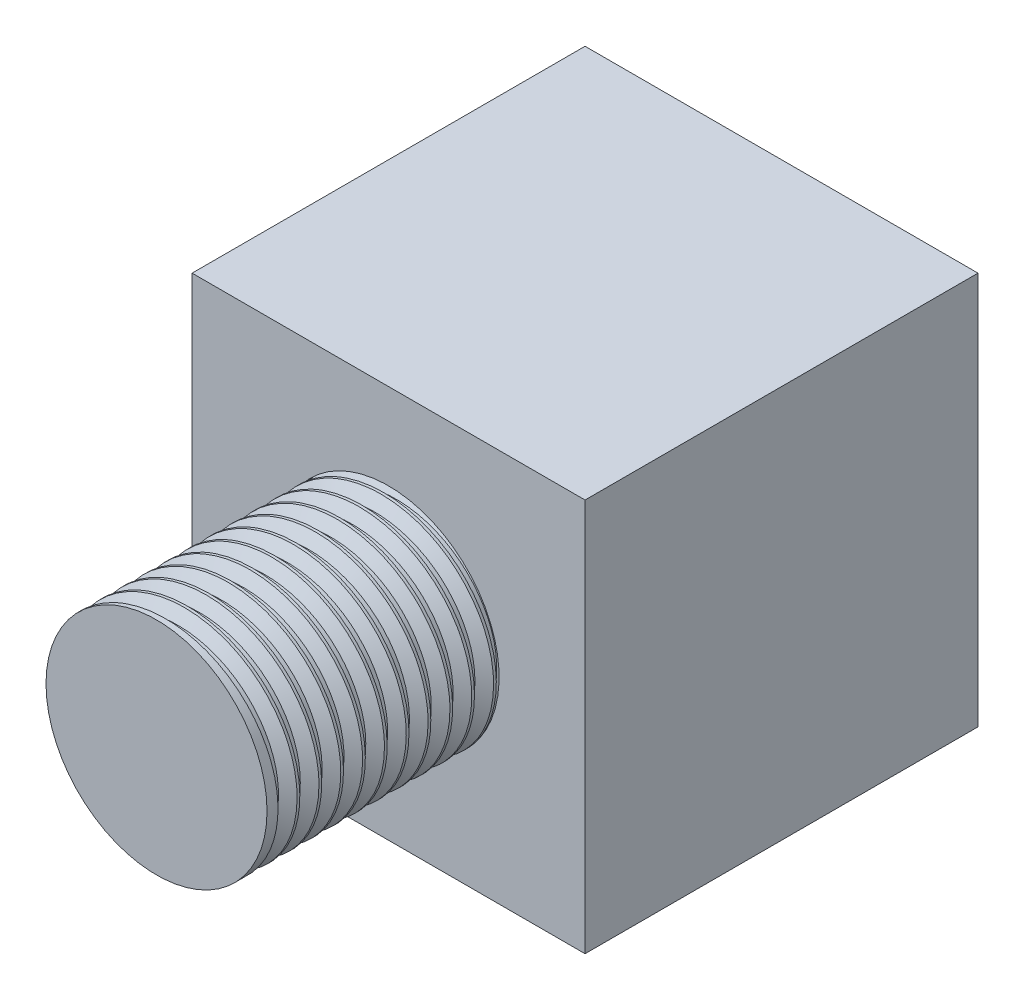
from build123d import *

# Parameters (mm, degrees)
SKETCH1_W                    = 25.4
SKETCH1_H                    = 25.4
BOSS_EXTRUDE1_DEPTH          = 25.4
SKETCH2_R                    = 7.14375
BOSS_EXTRUDE2_DEPTH          = 15
F_9_16_18_TAPPED_HOLE3_D     = 13.09624
F_9_16_18_TAPPED_HOLE3_DEPTH = 14.9999954
F_9_16_18_TAPPED_HOLE3_TIP   = 3.934507437
THREAD1_PITCH                = 1.411111111


with BuildPart() as part:
    # Sketch1 → Boss-Extrude1 (new body)
    with BuildSketch(Plane.XY):
        Rectangle(SKETCH1_W, SKETCH1_H)
    extrude(amount=BOSS_EXTRUDE1_DEPTH)

    # Sketch2 → Boss-Extrude2 (add)
    with BuildSketch(Plane.XY.offset(25.4)):
        with Locations(Location((0, 0, 0), (0, 0, 180))):
            Circle(SKETCH2_R)
    extrude(amount=BOSS_EXTRUDE2_DEPTH)

    # 9/16-18 Tapped Hole3
    with Locations(Plane(origin=(0, 0, 0), x_dir=(1, 0, 0), z_dir=(0, 0, -1))):
        with Locations((0, 0)):
            Hole(F_9_16_18_TAPPED_HOLE3_D / 2, depth=F_9_16_18_TAPPED_HOLE3_DEPTH)
            with Locations((0, 0, -(F_9_16_18_TAPPED_HOLE3_DEPTH + F_9_16_18_TAPPED_HOLE3_TIP / 2))):  # 118° drill point
                Cone(0, F_9_16_18_TAPPED_HOLE3_D / 2, F_9_16_18_TAPPED_HOLE3_TIP, mode=Mode.SUBTRACT)

    # Thread1: the profile of Thread Profile1 profile screwed along a right-hand helix of 10.629921 turns, 8 arcs to a turn; built about Z, then put on its axis
    thread1_z = Axis((0, 0, 0), (0, 0, 1))
    thread1_corners = [(7.14405, 0, -0.000173205), (7.14405, 0, 1.234895423), (6.37996371, 0, 0.793749998), (6.37996371, 0, 0.44097222)]
    with BuildLine(mode=Mode.PRIVATE) as thread1_profile:
        Line(thread1_corners[0], thread1_corners[1])
        Line(thread1_corners[1], thread1_corners[2])
        Line(thread1_corners[2], thread1_corners[3])
        Line(thread1_corners[3], thread1_corners[0])
    thread1_cap = Face(thread1_profile.wire())
    thread1_turn_angles = [0, 22.5, 45, 67.5, 90, 112.5, 135, 157.5, 180, 202.5, 225, 247.5, 270, 292.5, 315, 337.5, 360]
    thread1_turn_weights = [1, 0.9238795325112867, 1, 0.9238795325112867, 1, 0.9238795325112867, 1, 0.9238795325112867, 1, 0.9238795325112867, 1, 0.9238795325112867, 1, 0.9238795325112867, 1, 0.9238795325112867, 1]
    thread1_turn_rails = [Edge.make_bspline([Vector(p[0], p[1], 0).rotate(thread1_z, thread1_turn_angles[k]) / thread1_turn_weights[k] + Vector(0, 0, p[2] + THREAD1_PITCH * thread1_turn_angles[k] / 360) for k in range(17)], [0, 0, 0, 1, 1, 2, 2, 3, 3, 4, 4, 5, 5, 6, 6, 7, 7, 8, 8, 8], 2, thread1_turn_weights) for p in thread1_corners]
    thread1_turn_sides = [Face.make_surface_from_curves(thread1_turn_rails[p[0]], thread1_turn_rails[p[1]]) for p in [(0, 1), (1, 2), (2, 3), (3, 0)]]
    thread1_last_angles = [3600, 3622.5, 3645, 3667.5, 3690, 3712.5, 3735, 3757.5, 3780, 3802.5, 3825, 3825.885826772, 3826.771653543]
    thread1_last_weights = [1, 0.9238795325112867, 1, 0.9238795325112867, 1, 0.9238795325112867, 1, 0.9238795325112867, 1, 0.9238795325112867, 1, 0.999880487400795, 1]
    thread1_last_rails = [Edge.make_bspline([Vector(p[0], p[1], 0).rotate(thread1_z, thread1_last_angles[k]) / thread1_last_weights[k] + Vector(0, 0, p[2] + THREAD1_PITCH * thread1_last_angles[k] / 360) for k in range(13)], [0, 0, 0, 1, 1, 2, 2, 3, 3, 4, 4, 5, 5, 6, 6, 6], 2, thread1_last_weights) for p in thread1_corners]
    thread1_last_sides = [Face.make_surface_from_curves(thread1_last_rails[p[0]], thread1_last_rails[p[1]]) for p in [(0, 1), (1, 2), (2, 3), (3, 0)]]
    thread1 = Plane(origin=(0, 0, 40.4), x_dir=(-1, 0, 0), z_dir=(0, 0, -1)) * Solid(Shell([*[p.moved(Location((0, 0, THREAD1_PITCH * i))) for i in range(10) for p in thread1_turn_sides], *thread1_last_sides, thread1_cap, thread1_cap.rotate(thread1_z, 3826.771653543).moved(Location((0, 0, THREAD1_PITCH * 3826.771653543 / 360)))]))
    add(thread1, mode=Mode.SUBTRACT)


solid = part.part
